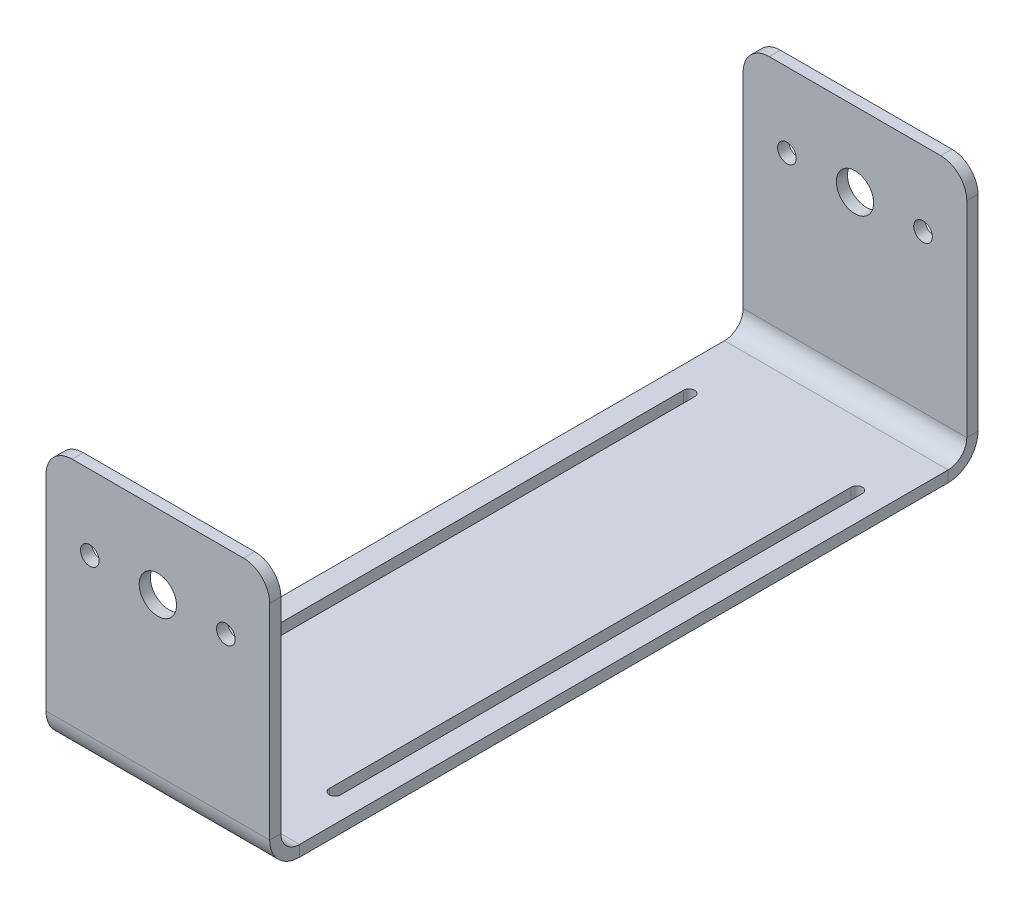
from build123d import *

# Parameters (mm, degrees)
BASE_FLANGE1_DEPTH = 60
SKETCH6_R          = 5
SKETCH6_R_2        = 2.5
CUT_EXTRUDE1_DEPTH = 212.187120819
CUT_EXTRUDE2_DEPTH = 10
FILLET1_R          = 7


# Sheet-metal steps are written as plain solids
with BuildPart() as part:
    # Sketch1 → Base-Flange1 (new body)
    with BuildSketch(Plane(origin=(0, 0, 0), x_dir=(0, 0, -1), z_dir=(1, 0, 0))):
        with BuildLine():
            Line((-95, 70), (-95, 8))
            ThreePointArc((-95, 8), (-92.656854249, 2.343145751), (-87, 0))
            Line((-87, 0), (87, 0))
            ThreePointArc((87, 0), (92.656854249, 2.343145751), (95, 8))
            Line((95, 8), (95, 70))
            Line((95, 70), (92, 70))
            Line((92, 70), (92, 8))
            ThreePointArc((92, 8), (90.535533906, 4.464466094), (87, 3))
            Line((87, 3), (-87, 3))
            ThreePointArc((-87, 3), (-90.535533906, 4.464466094), (-92, 8))
            Line((-92, 8), (-92, 70))
            Line((-92, 70), (-95, 70))
        make_face()
    extrude(amount=BASE_FLANGE1_DEPTH)

    # Sketch6 → Cut-Extrude1 (cut, through all)
    with BuildSketch(Plane.XY.offset(95)):
        with Locations((30, 50)):
            Circle(SKETCH6_R)
        with Locations((11.75, 50)):
            Circle(SKETCH6_R_2)
        with Locations((48.25, 50)):
            Circle(SKETCH6_R_2)
    extrude(amount=-CUT_EXTRUDE1_DEPTH, mode=Mode.SUBTRACT)

    # Sketch7 → Cut-Extrude2 (cut)
    with BuildSketch(Plane(origin=(0, 0, 0), x_dir=(-1, 0, 0), z_dir=(0, -1, 0))):
        with BuildLine():
            Line((-6, 70), (-6, -70))
            ThreePointArc((-6, -70), (-7.5, -71.5), (-9, -70))
            Line((-9, -70), (-9, 70))
            ThreePointArc((-9, 70), (-7.5, 71.5), (-6, 70))
        make_face()
        with BuildLine():
            Line((-54, 70), (-54, -70))
            ThreePointArc((-54, -70), (-52.5, -71.5), (-51, -70))
            Line((-51, -70), (-51, 70))
            ThreePointArc((-51, 70), (-52.5, 71.5), (-54, 70))
        make_face()
    extrude(amount=-CUT_EXTRUDE2_DEPTH, mode=Mode.SUBTRACT)

    # Fillet1
    fillet1_edges = [part.edges().sort_by_distance(p)[0] for p in [
        (0, 70, -93.5),
        (0, 70, 93.5),
        (60, 70, -93.5),
        (60, 70, 93.5),
    ]]
    fillet(fillet1_edges, radius=FILLET1_R)


solid = part.part
